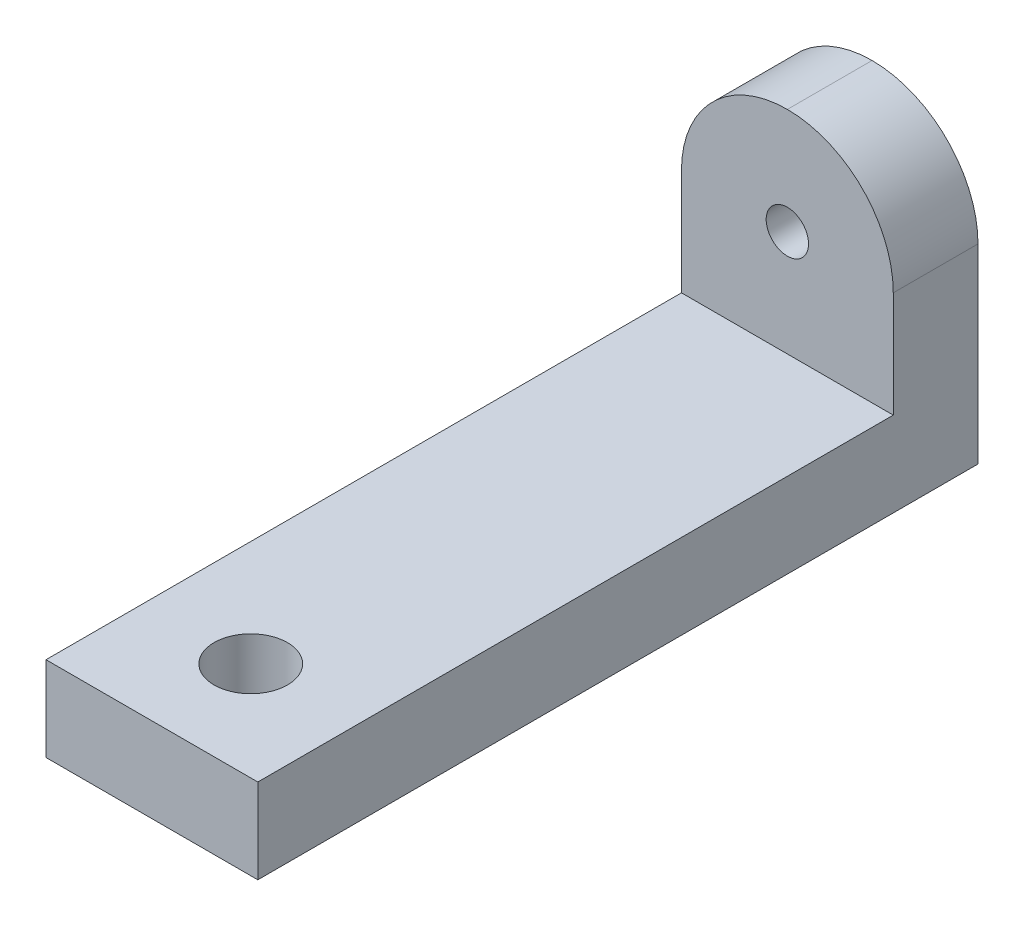
from build123d import *

# Parameters (mm, degrees)
BOSS_EXTRUDE1_DEPTH = 15
SKETCH2_R           = 2.6
CUT_EXTRUDE1_DEPTH  = 56.235857919
SKETCH3_R           = 1.5
CUT_EXTRUDE2_DEPTH  = 52.874849397
FILLET1_R           = 7.5


with BuildPart() as part:
    # Sketch1 → Boss-Extrude1 (new body)
    with BuildSketch(Plane(origin=(0, 0, 0), x_dir=(0, 0, -1), z_dir=(1, 0, 0))):
        Polygon((0, 0), (51, 0), (51, 3.916666667), (51, 21), (45, 21), (45, 6), (0, 6), align=None)
    extrude(amount=BOSS_EXTRUDE1_DEPTH)

    # Sketch2 → Cut-Extrude1 (cut, through all)
    with BuildSketch(Plane(origin=(0, 6, 0), x_dir=(1, 0, 0), z_dir=(0, 1, 0))):
        with Locations(Location((7.5, 7, 0), (0, 0, 270))):
            Circle(SKETCH2_R)
    extrude(amount=-CUT_EXTRUDE1_DEPTH, mode=Mode.SUBTRACT)

    # Sketch3 → Cut-Extrude2 (cut, through all)
    with BuildSketch(Plane.XY.offset(-45)):
        with Locations((7.5, 13.5)):
            Circle(SKETCH3_R)
    extrude(amount=-CUT_EXTRUDE2_DEPTH, mode=Mode.SUBTRACT)

    # Fillet1
    fillet1_edges = [part.edges().sort_by_distance(p)[0] for p in [
        (0, 21, -48),
        (15, 21, -48),
    ]]
    fillet(fillet1_edges, radius=FILLET1_R - 0.0001)  # a hair under: the kernel refuses the full size


solid = part.part
